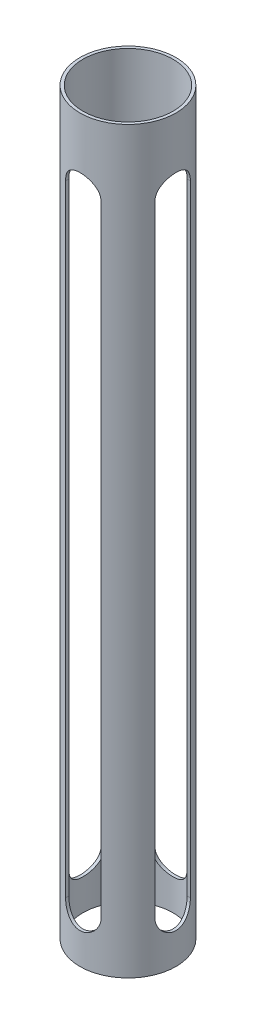
from build123d import *

# Parameters (mm, degrees)
SKETCH1_R           = 32.5
SKETCH1_R_2         = 30.5
BOSS_EXTRUDE1_DEPTH = 500
CUT_EXTRUDE1_DEPTH  = 50
CUT_EXTRUDE3_DEPTH  = 50


with BuildPart() as part:
    # Sketch1 → Boss-Extrude1 (new body)
    with BuildSketch(Plane(origin=(0, 0, 0), x_dir=(1, 0, 0), z_dir=(0, 1, 0))):
        Circle(SKETCH1_R)
        Circle(SKETCH1_R_2, mode=Mode.SUBTRACT)
    extrude(amount=BOSS_EXTRUDE1_DEPTH)

    # Sketch2 → Cut-Extrude1 (cut, symmetric)
    with BuildSketch(Plane.XY):
        with BuildLine():
            Line((12, 453.08072417), (12, 33.08072417))
            ThreePointArc((12, 33.08072417), (0, 21.08072417), (-12, 33.08072417))
            Line((-12, 33.08072417), (-12, 453.08072417))
            ThreePointArc((-12, 453.08072417), (0, 465.08072417), (12, 453.08072417))
        make_face()
    extrude(amount=CUT_EXTRUDE1_DEPTH, both=True, mode=Mode.SUBTRACT)

    # Sketch5 → Cut-Extrude3 (cut, symmetric)
    with BuildSketch(Plane(origin=(0, 0, 0), x_dir=(0, 0, -1), z_dir=(1, 0, 0))):
        with BuildLine():
            Line((12, 453.08072417), (12, 33.08072417))
            ThreePointArc((12, 33.08072417), (0, 21.08072417), (-12, 33.08072417))
            Line((-12, 33.08072417), (-12, 453.08072417))
            ThreePointArc((-12, 453.08072417), (0, 465.08072417), (12, 453.08072417))
        make_face()
    extrude(amount=CUT_EXTRUDE3_DEPTH, both=True, mode=Mode.SUBTRACT)


solid = part.part
